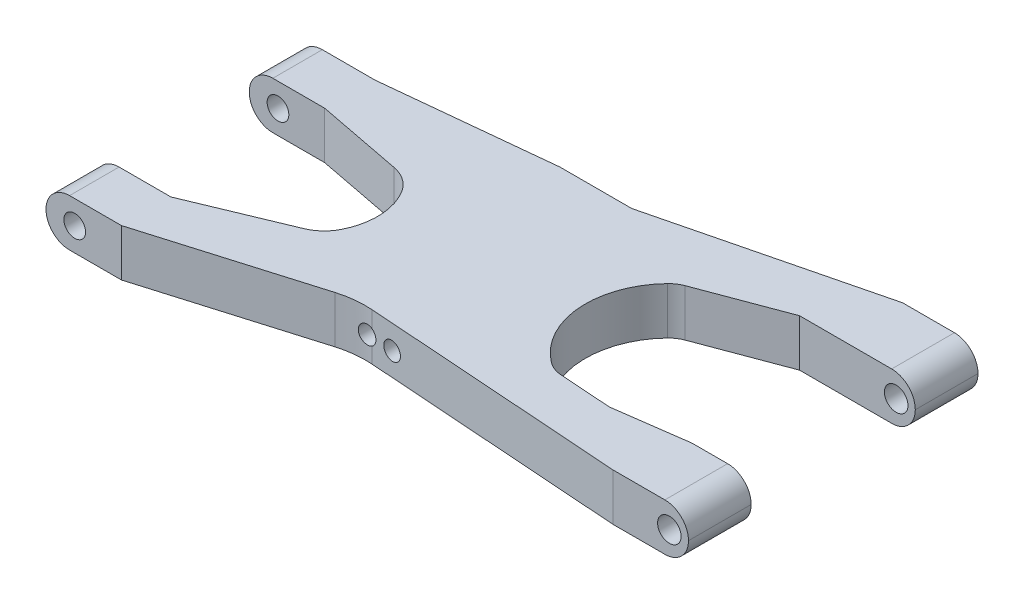
from build123d import *

# Parameters (mm, degrees)
BOSS_EXTRUDE1_DEPTH     = 6.35
FILLET2_R               = 3.175
CUT_EXTRUDE2_DEPTH      = 91.397918676
CUT_EXTRUDE2_DEPTH_BACK = 91.397918676
SKETCH2_R               = 1.5875
SKETCH2_R_2             = 1.4605
CUT_EXTRUDE5_DEPTH      = 91.942464482
CUT_EXTRUDE7_DEPTH      = 25.4
SKETCH6_W               = 10.4785697
SKETCH6_H               = 6.35
SKETCH6_R               = 1.2065
BOSS_EXTRUDE2_DEPTH     = 12.7
FILLET5_R               = 12.7
FILLET6_R               = 5.08
BOSS_EXTRUDE3_DEPTH     = 6.35
SKETCH10_R              = 1.2065
CUT_EXTRUDE9_DEPTH      = 90.841656328


with BuildPart() as part:
    # Sketch1 → Boss-Extrude1 (new body)
    with BuildSketch(Plane(origin=(0, 0, 0), x_dir=(1, 0, 0), z_dir=(0, 1, 0))):
        Polygon((0, 0), (0, 38.989), (-10.16, 38.989), (-71.628, 29.4386), (-81.915, 29.4386), (-81.915, -4.5974), (-71.755, -4.5974), (-10.16, 0), align=None)
    extrude(amount=BOSS_EXTRUDE1_DEPTH)

    # Fillet2
    fillet2_edges = [part.edges().sort_by_distance(p)[0] for p in [
        (0, 0, -19.4945),
        (0, 6.35, -19.4945),
        (-81.915, 0, -12.4206),
        (-81.915, 6.35, -12.4206),
    ]]
    fillet(fillet2_edges, radius=FILLET2_R - 0.0001)  # a hair under: the kernel refuses the full size

    # Sketch2 → Cut-Extrude2 (cut, two sides: drawn at the far end of the back side and taken through both)
    with BuildSketch(Plane(origin=(-0.604981675, 0, 0), x_dir=(-1, 0, 0), z_dir=(0, 0, -1)).offset(-CUT_EXTRUDE2_DEPTH_BACK)):
        with Locations((1.966275702, 3.175)):
            Circle(SKETCH2_R)
        with Locations(Location((77.44064574, 3.175, 0), (0, 0, 180))):
            Circle(SKETCH2_R_2)
    extrude(amount=CUT_EXTRUDE2_DEPTH + CUT_EXTRUDE2_DEPTH_BACK, mode=Mode.SUBTRACT)

    # Sketch3 → Cut-Extrude5 (cut, through all)
    with BuildSketch(Plane(origin=(0, 0, 0), x_dir=(1, 0, 0), z_dir=(0, 1, 0))):
        with BuildLine():
            Line((-81.915, 22.7711), (-71.755, 22.7711))
            Line((-71.755, 22.7711), (-58.487579402, 20.207642468))
            ThreePointArc((-58.487579402, 20.207642468), (-55.580114305, 14.192748547), (-57.777398298, 7.883687982))
            Line((-57.777398298, 7.883687982), (-71.755, 2.0701))
            Line((-71.755, 2.0701), (-81.915, 2.0701))
            Line((-81.915, 2.0701), (-81.915, 22.7711))
        make_face()
        with BuildLine():
            Line((0, 30.5435), (0, 8.4455))
            Line((0, 8.4455), (-7.9756, 8.4455))
            Line((-7.9756, 8.4455), (-17.739567161, 7.096263095))
            Line((-17.739567161, 7.096263095), (-24.764375431, 7.587485542))
            ThreePointArc((-24.764375431, 7.587485542), (-25.820245836, 7.814780317), (-26.769908004, 8.32923828))
            ThreePointArc((-26.769908004, 8.32923828), (-31.345543526, 16.545378703), (-28.210906636, 25.41191441))
            ThreePointArc((-28.210906636, 25.41191441), (-27.55579932, 25.957953915), (-26.795645997, 26.34459543))
            Line((-26.795645997, 26.34459543), (-15.585156538, 30.5435))
            Line((-15.585156538, 30.5435), (-7.9756, 30.5435))
            Line((-7.9756, 30.5435), (0, 30.5435))
        make_face()
    extrude(amount=CUT_EXTRUDE5_DEPTH, mode=Mode.SUBTRACT)

    # Sketch5 → Cut-Extrude7 (cut)
    with BuildSketch(Plane(origin=(0, 6.35, 0), x_dir=(1, 0, 0), z_dir=(0, 1, 0))):
        Polygon((-10.16, 38.989), (-53.78735915, 28.179846815), (-71.628, 29.4386), align=None)
        Polygon((-10.16, 0), (-47.394119509, 2.627067431), (-71.755, -4.5974), align=None)
    extrude(amount=-CUT_EXTRUDE7_DEPTH, mode=Mode.SUBTRACT)

    # Sketch6 → Boss-Extrude2 (add)
    with BuildSketch(Plane.XY.offset(-31.75)):
        with Locations((-43.810886798, 3.175)):
            Rectangle(SKETCH6_W, SKETCH6_H)
        with Locations((-45.72, 3.108706623)):
            Circle(SKETCH6_R, mode=Mode.SUBTRACT)
        with Locations((-42.164, 3.108706623)):
            Circle(SKETCH6_R, mode=Mode.SUBTRACT)
    extrude(amount=BOSS_EXTRUDE2_DEPTH)

    # Fillet5
    fillet5_edges = [part.edges().sort_by_distance(p)[0] for p in [
        (-53.78735915, 3.175, -28.179846815),
        (-47.394119509, 3.175, -2.627067431),
    ]]
    fillet(fillet5_edges, radius=FILLET5_R)

    # Fillet6
    fillet6_edges = [part.edges().sort_by_distance(p)[0] for p in [
        (-57.777398298, 3.175, -7.883687982),
        (-58.487579402, 3.175, -20.207642468),
    ]]
    fillet(fillet6_edges, radius=FILLET6_R)

    # Sketch9 → Boss-Extrude3 (add)
    with BuildSketch(Plane(origin=(0, 6.35, 0), x_dir=(1, 0, 0), z_dir=(0, 1, 0))):
        Polygon((-49.050171648, 31.75), (-71.628, 29.4386), (-71.628, 26.697361781), (-49.050171648, 26.697361781), align=None)
    extrude(amount=-BOSS_EXTRUDE3_DEPTH)

    # Sketch10 → Cut-Extrude9 (cut, through all)
    with BuildSketch(Plane(origin=(0, 0, -31.75), x_dir=(-1, 0, 0), z_dir=(0, 0, -1))):
        with Locations((42.164, 3.108706623)):
            Circle(SKETCH10_R)
        with Locations(Location((45.72, 3.108706623, 0), (0, 0, 121.083308631))):
            Circle(SKETCH10_R)
    extrude(amount=-CUT_EXTRUDE9_DEPTH, mode=Mode.SUBTRACT)


solid = part.part
